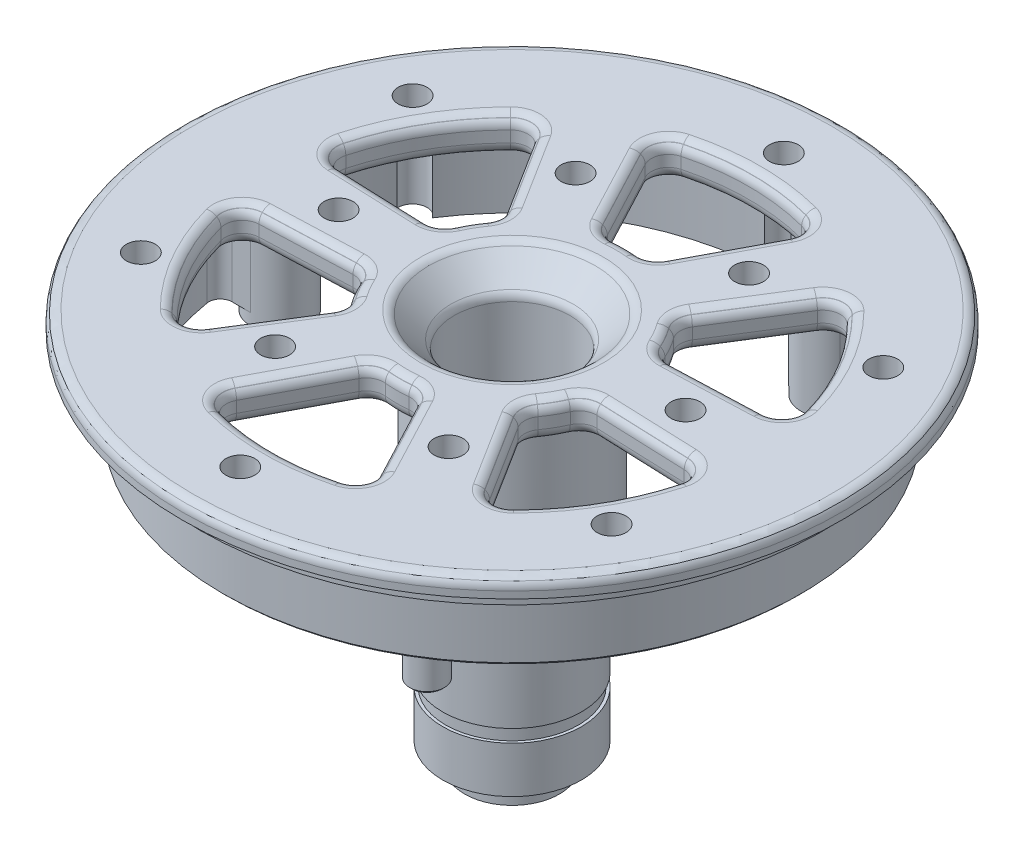
from build123d import *

# Parameters (mm, degrees)
CIRPATTERN1_COUNT        = 3
CHAMFER1_SIZE            = 0.5
CHAMFER2_SIZE            = 2.5
FLANGE_CUTOUTS_DEPTH     = 48.428894147
FILLET1_R                = 1.5
M3X0_5_TAPPED_HOLE1_D    = 2.5
CIRPATTERN2_COUNT        = 6
FILLET1_OF_CIRPATTERN2_R = 1.5
SKETCH10_W               = 1.207732619
SKETCH10_H               = 1.1
SKETCH11_W               = 3.151954219
SKETCH11_H               = 1.1
M3X0_5_TAPPED_HOLE2_D    = 2.5
CIRPATTERN3_COUNT        = 6
CHAMFER3_SIZE            = 0.6
CHAMFER4_SIZE            = 0.2
FILLET2_R                = 1
BOSS_EXTRUDE1_REACH      = 49.538
FILLET4_R                = 1
CIRPATTERN4_COUNT        = 3
FILLET4_OF_CIRPATTERN4_R = 1


with BuildPart() as part:
    # Sketch2 → Revolve1 (revolve)
    with BuildSketch(Plane.XY, mode=Mode.PRIVATE) as revolve1_sk:
        Polygon((-4, 10), (-4, -6.207108491), (-3.1, -6.207108491), (-3.1, -9.207108491), (-4.1, -9.207108491), (-4.1, -7.207108491), (-6, -7.207108491), (-6, 10), (-7, 10), (-7, 22), (-23, 22), (-23, 16), (-24.75, 16), (-25, 16.25), (-25, 22), (-27, 22), (-27, 23.5), (-28.5, 23.5), (-28.5, 25), (-5, 25), (-5, 11), align=None)
    revolve(revolve1_sk.sketch.rotate(Axis((0, 0, 0), (0, -1, 0)), 270), axis=Axis((0, 0, 0), (0, -1, 0)))

    # Sketch3 → Revolve2 (revolve)
    with BuildSketch(Plane.XY):
        Polygon((-21.6, 15), (-22.6, 15), (-22.6, 22), (-20.1, 22), (-20.1, 11), (-21.6, 11), align=None)
    revolve2 = revolve(axis=Axis((-20.1, 18.273035546, 0), (0, -1, 0)))

    # CirPattern1: Revolve2 ×3 about axis
    cirpattern1_axis = Axis((0, 0, 0), (0, 1, 0))
    for i in range(1, CIRPATTERN1_COUNT):
        add(revolve2.rotate(cirpattern1_axis, i * 360 / CIRPATTERN1_COUNT))

    # Chamfer1
    chamfer1_edges = [part.edges().sort_by_distance(p)[0] for p in [
        (0, 25, -28.5),
    ]]
    chamfer(chamfer1_edges, length=CHAMFER1_SIZE)

    # Chamfer2
    chamfer2_edges = [part.edges().sort_by_distance(p)[0] for p in [
        (0, 25, -5),
    ]]
    chamfer(chamfer2_edges, length=CHAMFER2_SIZE)

    # Sketch6 → Flange cutouts (cut, through all)
    with BuildSketch(Plane(origin=(0, 0, 0), x_dir=(1, 0, 0), z_dir=(0, 1, 0))):
        with BuildLine():
            Line((20.186446596, 3.571746608), (9.485281374, 3.166928678))
            ThreePointArc((9.485281374, 3.166928678), (8.660254038, 5), (7.485281374, 6.631030293))
            Line((7.485281374, 6.631030293), (13.186446596, 15.69610226))
            ThreePointArc((13.186446596, 15.69610226), (17.753520778, 10.25), (20.186446596, 3.571746608))
        make_face()
    flange_cutouts = extrude(amount=FLANGE_CUTOUTS_DEPTH, mode=Mode.SUBTRACT)

    # Fillet1
    fillet1_edges = [part.edges().sort_by_distance(p)[0] for p in [
        (20.186446596, 23.5, -3.571746608),
        (13.186446596, 23.5, -15.69610226),
        (7.485281374, 23.5, -6.631030293),
        (9.485281374, 23.5, -3.166928678),
    ]]
    fillet(fillet1_edges, radius=FILLET1_R)

    # M3x0.5 Tapped Hole1 (through all)
    with Locations(Plane(origin=(0, 25, 0), x_dir=(1, 0, 0), z_dir=(0, 1, 0))):
        with Locations((15, 0)):
            m3x0_5_tapped_hole1 = Hole(M3X0_5_TAPPED_HOLE1_D / 2)

    # CirPattern2: Flange cutouts, M3x0.5 Tapped Hole1 ×6 about axis
    cirpattern2_axis = Axis((0, 0, 0), (0, 1, 0))
    add([flange_cutouts.rotate(cirpattern2_axis, i * 360 / CIRPATTERN2_COUNT) for i in range(1, CIRPATTERN2_COUNT)], mode=Mode.SUBTRACT)
    add([m3x0_5_tapped_hole1.rotate(cirpattern2_axis, i * 360 / CIRPATTERN2_COUNT) for i in range(1, CIRPATTERN2_COUNT)], mode=Mode.SUBTRACT)

    # Fillet1 of CirPattern2
    fillet1_of_cirpattern2_edges = [part.edges().sort_by_distance(p)[0] for p in [
        (7, 23.5, -19.267848868),
        (-7, 23.5, -19.267848868),
        (-2, 23.5, -9.797958971),
        (2, 23.5, -9.797958971),
        (-13.186446596, 23.5, -15.69610226),
        (-20.186446596, 23.5, -3.571746608),
        (-9.485281374, 23.5, -3.166928678),
        (-7.485281374, 23.5, -6.631030293),
        (-20.186446596, 23.5, 3.571746608),
        (-13.186446596, 23.5, 15.69610226),
        (-7.485281374, 23.5, 6.631030293),
        (-9.485281374, 23.5, 3.166928678),
        (-7, 23.5, 19.267848868),
        (7, 23.5, 19.267848868),
        (2, 23.5, 9.797958971),
        (-2, 23.5, 9.797958971),
        (13.186446596, 23.5, 15.69610226),
        (20.186446596, 23.5, 3.571746608),
        (9.485281374, 23.5, 3.166928678),
        (7.485281374, 23.5, 6.631030293),
    ]]
    fillet(fillet1_of_cirpattern2_edges, radius=FILLET1_OF_CIRPATTERN2_R)

    # Sketch10 → Cut-Revolve2 (revolve, cut)
    with BuildSketch(Plane.XY, mode=Mode.PRIVATE) as cut_revolve2_sk:
        with Locations((-6.35386631, 5.45)):
            Rectangle(SKETCH10_W, SKETCH10_H)
    revolve(cut_revolve2_sk.sketch.rotate(Axis((0, 0, 0), (0, 1, 0)), 90), axis=Axis((0, 0, 0), (0, 1, 0)), mode=Mode.SUBTRACT)

    # Sketch11 → Cut-Revolve3 (revolve, cut)
    with BuildSketch(Plane.XY, mode=Mode.PRIVATE) as cut_revolve3_sk:
        with Locations((-7.32597711, -2.657108491)):
            Rectangle(SKETCH11_W, SKETCH11_H)
    revolve(cut_revolve3_sk.sketch.rotate(Axis((0, 0, 0), (0, -1, 0)), 270), axis=Axis((0, 0, 0), (0, -1, 0)), mode=Mode.SUBTRACT)

    # M3x0.5 Tapped Hole2 (through all)
    with Locations(Plane(origin=(0, 25, 0), x_dir=(1, 0, 0), z_dir=(0, 1, 0))):
        with Locations((0, 23.5)):
            m3x0_5_tapped_hole2 = Hole(M3X0_5_TAPPED_HOLE2_D / 2)

    # CirPattern3: M3x0.5 Tapped Hole2 ×6 about axis
    cirpattern3_axis = Axis((0, 0, 0), (0, 1, 0))
    for i in range(1, CIRPATTERN3_COUNT):
        add(m3x0_5_tapped_hole2.rotate(cirpattern3_axis, i * 360 / CIRPATTERN3_COUNT), mode=Mode.SUBTRACT)

    # Chamfer3
    chamfer3_edges = [part.edges().sort_by_distance(p)[0] for p in [
        (4.328114207, 25, -14.207356012),
        (4.328114207, 22, -14.207356012),
        (0, 25, -20.5),
        (0, 22, -20.5),
        (0, 25, -10),
        (0, 22, -10),
        (-4.328114207, 25, -14.207356012),
        (-4.328114207, 22, -14.207356012),
        (6.205767262, 22, -18.978492483),
        (6.205767262, 25, -18.978492483),
        (1.878799055, 22, -10.117806836),
        (1.878799055, 25, -10.117806836),
        (-1.878799055, 22, -10.117806836),
        (-1.878799055, 25, -10.117806836),
        (-6.205767262, 22, -18.978492483),
        (-6.205767262, 25, -18.978492483),
        (-10.139874124, 25, -10.851934859),
        (-10.139874124, 22, -10.851934859),
        (-17.753520778, 25, -10.25),
        (-17.753520778, 22, -10.25),
        (-8.660254038, 25, -5),
        (-8.660254038, 22, -5),
        (-14.46798833, 25, -3.355421153),
        (-14.46798833, 22, -3.355421153),
        (-13.332972985, 22, -14.86359834),
        (-13.332972985, 25, -14.86359834),
        (-7.822878223, 22, -6.685991128),
        (-7.822878223, 25, -6.685991128),
        (-9.701677278, 22, -3.431815708),
        (-9.701677278, 25, -3.431815708),
        (-19.538740247, 22, -4.114894143),
        (-19.538740247, 25, -4.114894143),
        (-14.46798833, 25, 3.355421153),
        (-14.46798833, 22, 3.355421153),
        (-17.753520778, 25, 10.25),
        (-17.753520778, 22, 10.25),
        (-8.660254038, 25, 5),
        (-8.660254038, 22, 5),
        (-10.139874124, 25, 10.851934859),
        (-10.139874124, 22, 10.851934859),
        (-19.538740247, 22, 4.114894143),
        (-19.538740247, 25, 4.114894143),
        (-9.701677278, 22, 3.431815708),
        (-9.701677278, 25, 3.431815708),
        (-7.822878223, 22, 6.685991128),
        (-7.822878223, 25, 6.685991128),
        (-13.332972985, 22, 14.86359834),
        (-13.332972985, 25, 14.86359834),
        (-4.328114207, 25, 14.207356012),
        (-4.328114207, 22, 14.207356012),
        (0, 25, 20.5),
        (0, 22, 20.5),
        (0, 25, 10),
        (0, 22, 10),
        (4.328114207, 25, 14.207356012),
        (4.328114207, 22, 14.207356012),
        (-6.205767262, 22, 18.978492483),
        (-6.205767262, 25, 18.978492483),
        (-1.878799055, 22, 10.117806836),
        (-1.878799055, 25, 10.117806836),
        (1.878799055, 22, 10.117806836),
        (1.878799055, 25, 10.117806836),
        (6.205767262, 22, 18.978492483),
        (6.205767262, 25, 18.978492483),
        (10.139874124, 25, 10.851934859),
        (10.139874124, 22, 10.851934859),
        (17.753520778, 25, 10.25),
        (17.753520778, 22, 10.25),
        (8.660254038, 25, 5),
        (8.660254038, 22, 5),
        (14.46798833, 25, 3.355421153),
        (14.46798833, 22, 3.355421153),
        (13.332972985, 22, 14.86359834),
        (13.332972985, 25, 14.86359834),
        (7.822878223, 22, 6.685991128),
        (7.822878223, 25, 6.685991128),
        (9.701677278, 22, 3.431815708),
        (9.701677278, 25, 3.431815708),
        (19.538740247, 22, 4.114894143),
        (19.538740247, 25, 4.114894143),
        (14.46798833, 25, -3.355421153),
        (14.46798833, 22, -3.355421153),
        (17.753520778, 25, -10.25),
        (17.753520778, 22, -10.25),
        (8.660254038, 25, -5),
        (8.660254038, 22, -5),
        (10.139874124, 25, -10.851934859),
        (10.139874124, 22, -10.851934859),
        (19.538740247, 22, -4.114894143),
        (19.538740247, 25, -4.114894143),
        (9.701677278, 22, -3.431815708),
        (9.701677278, 25, -3.431815708),
        (7.822878223, 22, -6.685991128),
        (7.822878223, 25, -6.685991128),
        (13.332972985, 22, -14.86359834),
        (13.332972985, 25, -14.86359834),
    ]]
    chamfer(chamfer3_edges, length=CHAMFER3_SIZE)

    # Chamfer4
    chamfer4_edges = [part.edges().sort_by_distance(p)[0] for p in [
        (-18.6, 11, 0),
        (9.3, 11, 16.10807251),
        (9.3, 11, -16.10807251),
    ]]
    chamfer(chamfer4_edges, length=CHAMFER4_SIZE)

    # Fillet2
    fillet2_edges = [part.edges().sort_by_distance(p)[0] for p in [
        (18.27313602, 22, -10.55),
        (13.267298962, 22, -15.459993279),
        (20.022396403, 22, -3.759821301),
        (9.631970971, 22, -11.171363078),
        (14.490669706, 22, -2.75585001),
        (7.223187124, 22, -6.666740527),
        (9.385160219, 22, -2.922093282),
        (8.140638796, 22, -4.7),
        (18.27313602, 22, 10.55),
        (20.022396403, 22, 3.759821301),
        (13.267298962, 22, 15.459993279),
        (14.490669706, 22, 2.75585001),
        (9.631970971, 22, 11.171363078),
        (9.385160219, 22, 2.922093282),
        (7.223187124, 22, 6.666740527),
        (8.140638796, 22, 4.7),
        (0, 22, -21.1),
        (-6.755097441, 22, -19.21981458),
        (6.755097441, 22, -19.21981458),
        (-4.858698735, 22, -13.927213088),
        (4.858698735, 22, -13.927213088),
        (-2.161973095, 22, -9.58883381),
        (2.161973095, 22, -9.58883381),
        (0, 22, -9.4),
        (-18.27313602, 22, -10.55),
        (-20.022396403, 22, -3.759821301),
        (-13.267298962, 22, -15.459993279),
        (-14.490669706, 22, -2.75585001),
        (-9.631970971, 22, -11.171363078),
        (-9.385160219, 22, -2.922093282),
        (-7.223187124, 22, -6.666740527),
        (-8.140638796, 22, -4.7),
        (-18.27313602, 22, 10.55),
        (-13.267298962, 22, 15.459993279),
        (-20.022396403, 22, 3.759821301),
        (-9.631970971, 22, 11.171363078),
        (-14.490669706, 22, 2.75585001),
        (-7.223187124, 22, 6.666740527),
        (-9.385160219, 22, 2.922093282),
        (-8.140638796, 22, 4.7),
        (0, 22, 21.1),
        (6.755097441, 22, 19.21981458),
        (-6.755097441, 22, 19.21981458),
        (4.858698735, 22, 13.927213088),
        (-4.858698735, 22, 13.927213088),
        (2.161973095, 22, 9.58883381),
        (-2.161973095, 22, 9.58883381),
        (0, 22, 9.4),
        (0, 24.4, 10),
        (0, 22.6, 10),
        (-1.878799055, 24.4, 10.117806836),
        (-1.878799055, 22.6, 10.117806836),
        (1.878799055, 24.4, 10.117806836),
        (1.878799055, 22.6, 10.117806836),
        (-4.328114207, 24.4, 14.207356012),
        (-4.328114207, 22.6, 14.207356012),
        (4.328114207, 24.4, 14.207356012),
        (4.328114207, 22.6, 14.207356012),
        (-6.205767262, 24.4, 18.978492483),
        (-6.205767262, 22.6, 18.978492483),
        (6.205767262, 24.4, 18.978492483),
        (6.205767262, 22.6, 18.978492483),
        (0, 24.4, 20.5),
        (0, 22.6, 20.5),
        (-8.660254038, 24.4, 5),
        (-8.660254038, 22.6, 5),
        (-9.701677278, 24.4, 3.431815708),
        (-9.701677278, 22.6, 3.431815708),
        (-7.822878223, 24.4, 6.685991128),
        (-7.822878223, 22.6, 6.685991128),
        (-14.46798833, 24.4, 3.355421153),
        (-14.46798833, 22.6, 3.355421153),
        (-10.139874124, 24.4, 10.851934859),
        (-10.139874124, 22.6, 10.851934859),
        (-19.538740247, 24.4, 4.114894143),
        (-19.538740247, 22.6, 4.114894143),
        (-13.332972985, 24.4, 14.86359834),
        (-13.332972985, 22.6, 14.86359834),
        (-17.753520778, 24.4, 10.25),
        (-17.753520778, 22.6, 10.25),
        (-8.660254038, 24.4, -5),
        (-8.660254038, 22.6, -5),
        (-7.822878223, 24.4, -6.685991128),
        (-7.822878223, 22.6, -6.685991128),
        (-9.701677278, 24.4, -3.431815708),
        (-9.701677278, 22.6, -3.431815708),
        (-10.139874124, 24.4, -10.851934859),
        (-10.139874124, 22.6, -10.851934859),
        (-14.46798833, 24.4, -3.355421153),
        (-14.46798833, 22.6, -3.355421153),
        (-13.332972985, 24.4, -14.86359834),
        (-13.332972985, 22.6, -14.86359834),
        (-19.538740247, 24.4, -4.114894143),
        (-19.538740247, 22.6, -4.114894143),
        (-17.753520778, 24.4, -10.25),
        (-17.753520778, 22.6, -10.25),
        (0, 24.4, -10),
        (0, 22.6, -10),
        (1.878799055, 24.4, -10.117806836),
        (1.878799055, 22.6, -10.117806836),
        (-1.878799055, 24.4, -10.117806836),
        (-1.878799055, 22.6, -10.117806836),
        (4.328114207, 24.4, -14.207356012),
        (4.328114207, 22.6, -14.207356012),
        (-4.328114207, 24.4, -14.207356012),
        (-4.328114207, 22.6, -14.207356012),
        (6.205767262, 24.4, -18.978492483),
        (6.205767262, 22.6, -18.978492483),
        (-6.205767262, 24.4, -18.978492483),
        (-6.205767262, 22.6, -18.978492483),
        (0, 24.4, -20.5),
        (0, 22.6, -20.5),
        (8.660254038, 24.4, 5),
        (8.660254038, 22.6, 5),
        (7.822878223, 24.4, 6.685991128),
        (7.822878223, 22.6, 6.685991128),
        (9.701677278, 24.4, 3.431815708),
        (9.701677278, 22.6, 3.431815708),
        (10.139874124, 24.4, 10.851934859),
        (10.139874124, 22.6, 10.851934859),
        (14.46798833, 24.4, 3.355421153),
        (14.46798833, 22.6, 3.355421153),
        (13.332972985, 24.4, 14.86359834),
        (13.332972985, 22.6, 14.86359834),
        (19.538740247, 24.4, 4.114894143),
        (19.538740247, 22.6, 4.114894143),
        (17.753520778, 24.4, 10.25),
        (17.753520778, 22.6, 10.25),
        (8.660254038, 24.4, -5),
        (8.660254038, 22.6, -5),
        (9.701677278, 24.4, -3.431815708),
        (9.701677278, 22.6, -3.431815708),
        (7.822878223, 24.4, -6.685991128),
        (7.822878223, 22.6, -6.685991128),
        (14.46798833, 24.4, -3.355421153),
        (14.46798833, 22.6, -3.355421153),
        (10.139874124, 24.4, -10.851934859),
        (10.139874124, 22.6, -10.851934859),
        (19.538740247, 24.4, -4.114894143),
        (19.538740247, 22.6, -4.114894143),
        (13.332972985, 24.4, -14.86359834),
        (13.332972985, 22.6, -14.86359834),
        (17.753520778, 24.4, -10.25),
        (17.753520778, 22.6, -10.25),
        (0, 25, -21.1),
        (-6.755097441, 25, -19.21981458),
        (6.755097441, 25, -19.21981458),
        (-4.858698735, 25, -13.927213088),
        (4.858698735, 25, -13.927213088),
        (-2.161973095, 25, -9.58883381),
        (2.161973095, 25, -9.58883381),
        (0, 25, -9.4),
        (18.27313602, 25, -10.55),
        (13.267298962, 25, -15.459993279),
        (20.022396403, 25, -3.759821301),
        (9.631970971, 25, -11.171363078),
        (14.490669706, 25, -2.75585001),
        (7.223187124, 25, -6.666740527),
        (9.385160219, 25, -2.922093282),
        (8.140638796, 25, -4.7),
        (-18.27313602, 25, -10.55),
        (-20.022396403, 25, -3.759821301),
        (-13.267298962, 25, -15.459993279),
        (-14.490669706, 25, -2.75585001),
        (-9.631970971, 25, -11.171363078),
        (-9.385160219, 25, -2.922093282),
        (-7.223187124, 25, -6.666740527),
        (-8.140638796, 25, -4.7),
        (9.631970971, 25, 11.171363078),
        (13.267298962, 25, 15.459993279),
        (7.223187124, 25, 6.666740527),
        (18.27313602, 25, 10.55),
        (8.140638796, 25, 4.7),
        (20.022396403, 25, 3.759821301),
        (9.385160219, 25, 2.922093282),
        (14.490669706, 25, 2.75585001),
        (4.858698735, 25, 13.927213088),
        (2.161973095, 25, 9.58883381),
        (6.755097441, 25, 19.21981458),
        (0, 25, 9.4),
        (0, 25, 21.1),
        (-2.161973095, 25, 9.58883381),
        (-6.755097441, 25, 19.21981458),
        (-4.858698735, 25, 13.927213088),
        (-9.631970971, 25, 11.171363078),
        (-7.223187124, 25, 6.666740527),
        (-13.267298962, 25, 15.459993279),
        (-8.140638796, 25, 4.7),
        (-18.27313602, 25, 10.55),
        (-9.385160219, 25, 2.922093282),
        (-20.022396403, 25, 3.759821301),
        (-14.490669706, 25, 2.75585001),
        (0, 25, -28),
        (0, 22.5, -5),
        (0, 25, -7.5),
    ]]
    fillet(fillet2_edges, radius=FILLET2_R)

    # Fillet3: read off the stored shape, not the designer's step
    # Fillet3 outline → Fillet3 (revolve, cut)
    with BuildSketch(Plane.XY):
        with BuildLine():
            Line((28.5, 24.097746179), (28.5, 24.5))
            Line((28.5, 24.5), (28.292893219, 24.707106781))
            ThreePointArc((28.292893219, 24.707106781), (28.446808645, 24.419543305), (28.5, 24.097746179))
        make_face()
    revolve(axis=Axis((0, 0, 0), (0, 1, 0)), mode=Mode.SUBTRACT)

    # Fillet3 2 outline → Fillet3 2 (revolve)
    with BuildSketch(Plane.XY):
        with BuildLine():
            Line((7, 22), (7, 21))
            ThreePointArc((7, 21), (7.292893219, 21.707106781), (8, 22))
            Line((8, 22), (7, 22))
        make_face()
    revolve(axis=Axis((0, 0, 0), (0, 1, 0)))

    # Sketch14 → Boss-Extrude1 (add, up to next)
    with BuildSketch(Plane.XZ.offset(-16), mode=Mode.PRIVATE) as boss_extrude1_sk1:
        with BuildLine():
            Line((-22.86372673, 2.5), (-20.1, 2.5))
            ThreePointArc((-20.1, 2.5), (-17.6, 0), (-20.1, -2.5))
            Line((-20.1, -2.5), (-22.86372673, -2.5))
            ThreePointArc((-22.86372673, -2.5), (-23, 0), (-22.86372673, 2.5))
        make_face()
    boss_extrude1_tool1 = extrude(boss_extrude1_sk1.sketch, amount=-BOSS_EXTRUDE1_REACH, mode=Mode.PRIVATE) - part.part
    boss_extrude1 = boss_extrude1_tool1.solids().sort_by_distance((-20.513428, 16, 0))[0]
    add(boss_extrude1)

    # Fillet4
    fillet4_edges = [part.edges().sort_by_distance(p)[0] for p in [
        (-22.86372673, 19, -2.5),
        (-22.86372673, 19, 2.5),
    ]]
    fillet(fillet4_edges, radius=FILLET4_R)

    # CirPattern4: Boss-Extrude1 ×3 about axis
    cirpattern4_axis = Axis((0, 0, 0), (0, 1, 0))
    for i in range(1, CIRPATTERN4_COUNT):
        add(boss_extrude1.rotate(cirpattern4_axis, i * 360 / CIRPATTERN4_COUNT))

    # Fillet4 of CirPattern4
    fillet4_of_cirpattern4_edges = [part.edges().sort_by_distance(p)[0] for p in [
        (9.266799856, 19, 21.050568174),
        (13.596926875, 19, 18.550568174),
        (13.596926875, 19, -18.550568174),
        (9.266799856, 19, -21.050568174),
    ]]
    fillet(fillet4_of_cirpattern4_edges, radius=FILLET4_OF_CIRPATTERN4_R)


solid = part.part
